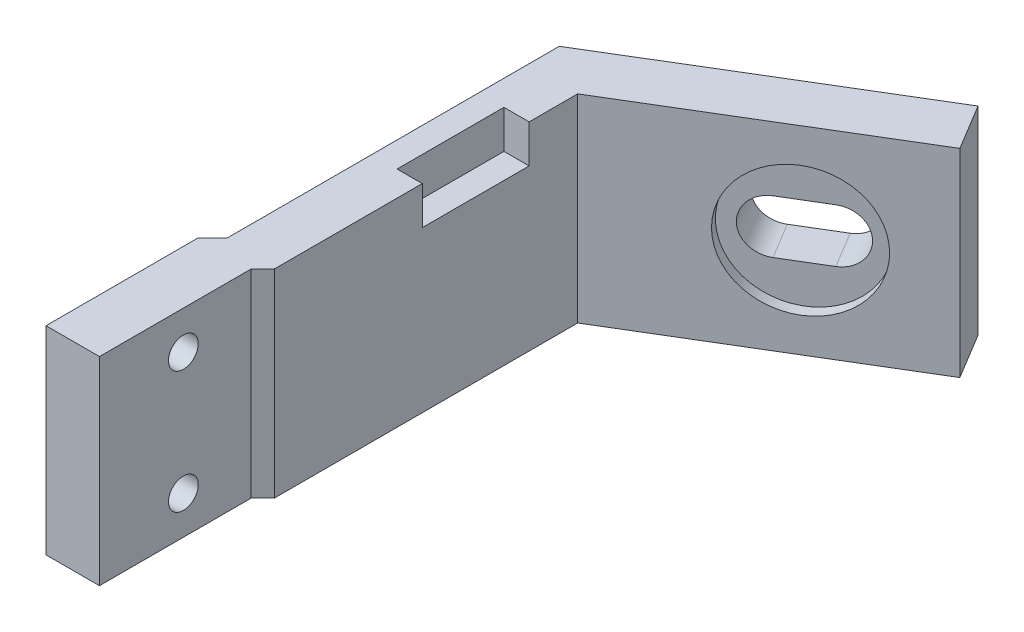
from build123d import *

# Parameters (mm, degrees)
LEG_AND_PAD_DEPTH          = 13
SCREW_HEAD_RELIEF_SKETCH_W = 14
SCREW_HEAD_RELIEF_SKETCH_H = 6
SCREW_HEAD_RELIEF_DEPTH    = 2.35
M6_SLOT_MIDDLE_DEPTH       = 3.5
SCREW_HOLES_SKETCH_R       = 1.95
SCREW_HOLES_DEPTH          = 4.5


with BuildPart() as part:
    # leg and pad sketch → leg and pad (new, symmetric)
    with BuildSketch(Plane(origin=(0, -20.7, 0), x_dir=(1, 0, 0), z_dir=(0, 1, 0))):
        Polygon((-0.4, 29.7585923), (-0.4, -9.98), (-1.92, -11.5), (-1.92, -31.37), (-8.92, -31.37), (-8.92, -11.5), (-7, -9.58), (-7, 33.951399666), (27.204821487, 54.594667874), (30.821788068, 48.601542416), align=None)
    extrude(amount=LEG_AND_PAD_DEPTH, both=True)

    # screw head relief sketch → screw head relief (cut, symmetric)
    with BuildSketch(Plane(origin=(-1.35, 0, 0), x_dir=(0, 0, -1), z_dir=(1, 0, 0))):
        with Locations((16.4, -9.7)):
            Rectangle(SCREW_HEAD_RELIEF_SKETCH_W, SCREW_HEAD_RELIEF_SKETCH_H)
    extrude(amount=SCREW_HEAD_RELIEF_DEPTH, both=True, mode=Mode.SUBTRACT)

    # insert flange relief sketch → insert flange relief (revolve, cut)
    with BuildSketch(Plane(origin=(0, -20.7, 0), x_dir=(1, 0, 0), z_dir=(0, 1, 0))):
        Polygon((18.324853729, 39.891397061), (17.03307995, 42.03179901), (9.755713323, 37.639768162), (11.047487102, 35.499366213), align=None)
    revolve(axis=Axis((18.324853729, -20.7, -39.891397061), (-0.5167095115681243, 0, -0.8561607796757748)), mode=Mode.SUBTRACT)

    # M6 slot end 1 sketch → M6 slot end 1 (revolve, cut)
    with BuildSketch(Plane(origin=(0, -20.7, 0), x_dir=(1, 0, 0), z_dir=(0, 1, 0))):
        Polygon((20.893336068, 41.441525596), (16.242950464, 49.146972613), (13.246387735, 47.338489322), (17.896773339, 39.633042305), align=None)
    revolve(axis=Axis((20.893336068, -20.7, -41.441525596), (-0.5167095115681233, 0, -0.8561607796757753)), mode=Mode.SUBTRACT)

    # M6 slot end 2 sketch → M6 slot end 2 (revolve, cut)
    with BuildSketch(Plane(origin=(0, -20.7, 0), x_dir=(1, 0, 0), z_dir=(0, 1, 0))):
        Polygon((15.75637139, 38.341268526), (11.105985786, 46.046715543), (8.109423057, 44.238232253), (12.759808661, 36.532785236), align=None)
    revolve(axis=Axis((15.75637139, -20.7, -38.341268526), (-0.5167095115681234, 0, -0.8561607796757752)), mode=Mode.SUBTRACT)

    # M6 slot middle sketch → M6 slot middle (cut, symmetric)
    with BuildSketch(Plane(origin=(0, -20.7, 0), x_dir=(1, 0, 0), z_dir=(0, 1, 0))):
        Polygon((15.75637139, 38.341268526), (20.893336068, 41.441525596), (16.242950464, 49.146972613), (11.105985786, 46.046715543), align=None)
    extrude(amount=M6_SLOT_MIDDLE_DEPTH, both=True, mode=Mode.SUBTRACT)

    # screw holes sketch → screw holes (cut, symmetric)
    with BuildSketch(Plane(origin=(-5.42, 0, 0), x_dir=(0, 0, -1), z_dir=(1, 0, 0))):
        with Locations((-20.375, -28.7)):
            Circle(SCREW_HOLES_SKETCH_R)
        with Locations((-20.375, -12.7)):
            Circle(SCREW_HOLES_SKETCH_R)
    extrude(amount=SCREW_HOLES_DEPTH, both=True, mode=Mode.SUBTRACT)


solid = part.part
